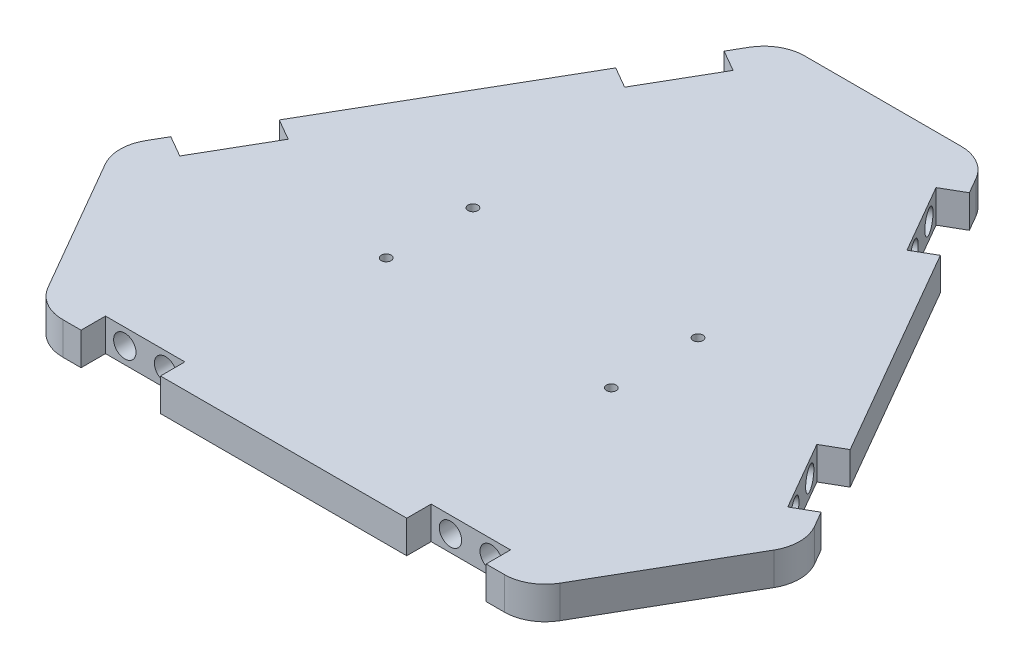
from build123d import *

# Parameters (mm, degrees)
BOSS_EXTRUDE1_DEPTH            = 4
CHAMFER1_SIZE                  = 50
SKETCH4_W                      = 19.5
SKETCH4_H                      = 8
SKETCH4_R                      = 2
CUT_EXTRUDE1_DEPTH             = 6
SKETCH4_2_R                    = 2
CUT_EXTRUDE2_DEPTH             = 16
SKETCH9_R                      = 2.75
CUT_EXTRUDE3_DEPTH             = 7
CRVPATTERN1_START              = -63.508529611
CRVPATTERN1_OUTLINE_W          = 19.5
CRVPATTERN1_OUTLINE_H          = 8
CRVPATTERN1_DEPTH              = 6
CRVPATTERN1_START_2            = -57.508529611
CRVPATTERN1_2_OUTLINE_R        = 2.75
CRVPATTERN1_2_DEPTH            = 7
CRVPATTERN1_START_3            = -50.508529611
CRVPATTERN1_3_OUTLINE_R        = 2
CRVPATTERN1_3_DEPTH            = 3
CRVPATTERN1_START_4            = 57.508529611
CRVPATTERN1_4_OUTLINE_W        = 19.5
CRVPATTERN1_4_OUTLINE_H        = 8
CRVPATTERN1_4_DEPTH            = 6
CRVPATTERN1_START_5            = 50.508529611
CRVPATTERN1_5_OUTLINE_R        = 2.75
CRVPATTERN1_5_DEPTH            = 7
CRVPATTERN1_START_6            = 47.508529611
CRVPATTERN1_6_OUTLINE_R        = 2
CRVPATTERN1_6_DEPTH            = 3
FILLET1_R                      = 10
CBORE_FOR_M2_SHCS1_D           = 2.4
CBORE_FOR_M2_SHCS1_CBORE_D     = 4.4
CBORE_FOR_M2_SHCS1_CBORE_DEPTH = 2


# Read off the part's stored shape, not the designer's step: CrvPattern1
with BuildPart() as part:
    # Sketch1 → Boss-Extrude1 (new, symmetric)
    with BuildSketch(Plane(origin=(0, 0, 0), x_dir=(1, 0, 0), z_dir=(0, 1, 0))):
        Polygon((110, -63.508529611), (0, 127.017059222), (-110, -63.508529611), align=None)
    extrude(amount=BOSS_EXTRUDE1_DEPTH, both=True)

    # Chamfer1
    chamfer1_edges = [part.edges().sort_by_distance(p)[0] for p in [
        (-110, 0, 63.508529611),
        (0, 0, -127.017059222),
        (110, 0, 63.508529611),
    ]]
    chamfer(chamfer1_edges, length=CHAMFER1_SIZE)

    # Sketch4 → Cut-Extrude1 (cut)
    with BuildSketch(Plane(origin=(4.375288244, 0, 63.508529611), x_dir=(-1, 0, 0), z_dir=(0, 0, -1))):
        with Locations((44.375288244, 0)):
            Rectangle(SKETCH4_W, SKETCH4_H)
        with Locations((39.375288244, 0)):
            Circle(SKETCH4_R, mode=Mode.SUBTRACT)
        with Locations((49.375288244, 0)):
            Circle(SKETCH4_R, mode=Mode.SUBTRACT)
    cut_extrude1 = extrude(amount=CUT_EXTRUDE1_DEPTH, mode=Mode.SUBTRACT)

    # Sketch4<2> → Cut-Extrude2 (cut)
    with BuildSketch(Plane(origin=(4.375288244, 0, 63.508529611), x_dir=(-1, 0, 0), z_dir=(0, 0, -1))):
        with Locations((49.375288244, 0)):
            Circle(SKETCH4_2_R)
        with Locations((39.375288244, 0)):
            Circle(SKETCH4_2_R)
    cut_extrude2 = extrude(amount=CUT_EXTRUDE2_DEPTH, mode=Mode.SUBTRACT)

    # Sketch9 → Cut-Extrude3 (cut)
    with BuildSketch(Plane.XY.offset(57.508529611)):
        with Locations((-45, 0)):
            Circle(SKETCH9_R)
        with Locations((-35, 0)):
            Circle(SKETCH9_R)
    cut_extrude3 = extrude(amount=-CUT_EXTRUDE3_DEPTH, mode=Mode.SUBTRACT)

    # Mirror1: Cut-Extrude1, Cut-Extrude2, Cut-Extrude3 across plane
    add(cut_extrude1.mirror(Plane(origin=(0, 0, 0), x_dir=(0, 0, 1), z_dir=(1, 0, 0))), mode=Mode.SUBTRACT)
    add(cut_extrude2.mirror(Plane(origin=(0, 0, 0), x_dir=(0, 0, 1), z_dir=(1, 0, 0))), mode=Mode.SUBTRACT)
    add(cut_extrude3.mirror(Plane(origin=(0, 0, 0), x_dir=(0, 0, 1), z_dir=(1, 0, 0))), mode=Mode.SUBTRACT)

    # CrvPattern1 outline → CrvPattern1 (cut)
    with BuildSketch(Plane(origin=(0, 0, 0), x_dir=(0.499999999999987, 0, -0.8660254037844463), z_dir=(0.8660254037844461, 0, 0.49999999999998707)).offset(CRVPATTERN1_START)):
        with Locations((-40, 0)):
            Rectangle(CRVPATTERN1_OUTLINE_W, CRVPATTERN1_OUTLINE_H)
        with Locations((40, 0)):
            Rectangle(CRVPATTERN1_OUTLINE_W, CRVPATTERN1_OUTLINE_H)
    extrude(amount=CRVPATTERN1_DEPTH, mode=Mode.SUBTRACT)

    # CrvPattern1 2 outline → CrvPattern1 2 (cut)
    with BuildSketch(Plane(origin=(0, 0, 0), x_dir=(0.499999999999987, 0, -0.8660254037844463), z_dir=(0.8660254037844461, 0, 0.49999999999998707)).offset(CRVPATTERN1_START_2)):
        with Locations((-45, 0)):
            Circle(CRVPATTERN1_2_OUTLINE_R)
        with Locations((-35, 0)):
            Circle(CRVPATTERN1_2_OUTLINE_R)
        with Locations((35, 0)):
            Circle(CRVPATTERN1_2_OUTLINE_R)
        with Locations((45, 0)):
            Circle(CRVPATTERN1_2_OUTLINE_R)
    extrude(amount=CRVPATTERN1_2_DEPTH, mode=Mode.SUBTRACT)

    # CrvPattern1 3 outline → CrvPattern1 3 (cut)
    with BuildSketch(Plane(origin=(0, 0, 0), x_dir=(0.499999999999987, 0, -0.8660254037844463), z_dir=(0.8660254037844461, 0, 0.49999999999998707)).offset(CRVPATTERN1_START_3)):
        with Locations((-45, 0)):
            Circle(CRVPATTERN1_3_OUTLINE_R)
        with Locations((-35, 0)):
            Circle(CRVPATTERN1_3_OUTLINE_R)
        with Locations((35, 0)):
            Circle(CRVPATTERN1_3_OUTLINE_R)
        with Locations((45, 0)):
            Circle(CRVPATTERN1_3_OUTLINE_R)
    extrude(amount=CRVPATTERN1_3_DEPTH, mode=Mode.SUBTRACT)

    # CrvPattern1 4 outline → CrvPattern1 4 (cut)
    with BuildSketch(Plane(origin=(0, 0, 0), x_dir=(0.500000000000001, 0, 0.866025403784438), z_dir=(0.866025403784438, 0, -0.500000000000001)).offset(CRVPATTERN1_START_4)):
        with Locations((-40, 0)):
            Rectangle(CRVPATTERN1_4_OUTLINE_W, CRVPATTERN1_4_OUTLINE_H)
        with Locations((40, 0)):
            Rectangle(CRVPATTERN1_4_OUTLINE_W, CRVPATTERN1_4_OUTLINE_H)
    extrude(amount=CRVPATTERN1_4_DEPTH, mode=Mode.SUBTRACT)

    # CrvPattern1 5 outline → CrvPattern1 5 (cut)
    with BuildSketch(Plane(origin=(0, 0, 0), x_dir=(0.500000000000001, 0, 0.866025403784438), z_dir=(0.866025403784438, 0, -0.500000000000001)).offset(CRVPATTERN1_START_5)):
        with Locations((-45, 0)):
            Circle(CRVPATTERN1_5_OUTLINE_R)
        with Locations((-35, 0)):
            Circle(CRVPATTERN1_5_OUTLINE_R)
        with Locations((35, 0)):
            Circle(CRVPATTERN1_5_OUTLINE_R)
        with Locations((45, 0)):
            Circle(CRVPATTERN1_5_OUTLINE_R)
    extrude(amount=CRVPATTERN1_5_DEPTH, mode=Mode.SUBTRACT)

    # CrvPattern1 6 outline → CrvPattern1 6 (cut)
    with BuildSketch(Plane(origin=(0, 0, 0), x_dir=(0.500000000000001, 0, 0.866025403784438), z_dir=(0.866025403784438, 0, -0.500000000000001)).offset(CRVPATTERN1_START_6)):
        with Locations((-45, 0)):
            Circle(CRVPATTERN1_6_OUTLINE_R)
        with Locations((-35, 0)):
            Circle(CRVPATTERN1_6_OUTLINE_R)
        with Locations((35, 0)):
            Circle(CRVPATTERN1_6_OUTLINE_R)
        with Locations((45, 0)):
            Circle(CRVPATTERN1_6_OUTLINE_R)
    extrude(amount=CRVPATTERN1_6_DEPTH, mode=Mode.SUBTRACT)

    # Fillet1
    fillet1_edges = [part.edges().sort_by_distance(p)[0] for p in [
        (60, 0, 63.508529611),
        (-60, 0, 63.508529611),
        (-25, 0, -83.715789032),
        (-85, 0, 20.207259422),
        (25, 0, -83.715789032),
        (85, 0, 20.207259422),
    ]]
    fillet(fillet1_edges, radius=FILLET1_R)

    # CBORE for M2 SHCS1 (through all)
    with Locations(Plane(origin=(0, -4, 0), x_dir=(-1, 0, 0), z_dir=(0, -1, 0))):
        with Locations((-27.65, -10.65), (27.65, 10.65), (27.65, -10.65), (-27.65, 10.65)):
            CounterBoreHole(CBORE_FOR_M2_SHCS1_D / 2, CBORE_FOR_M2_SHCS1_CBORE_D / 2, CBORE_FOR_M2_SHCS1_CBORE_DEPTH)


solid = part.part
